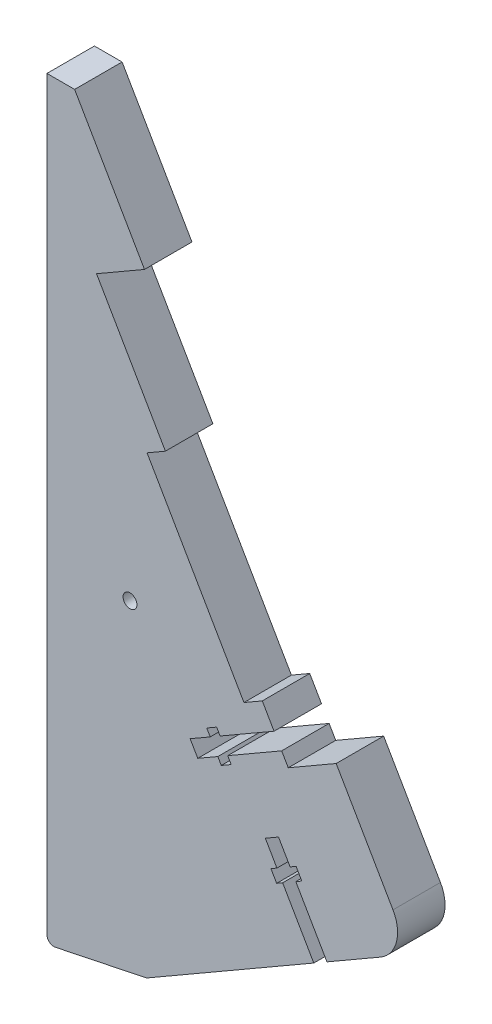
from build123d import *

# Parameters (mm, degrees)
SKETCH1_W                = 100
SKETCH1_H                = 110
BOSS_EXTRUDE1_DEPTH      = 6.86
BOSS_EXTRUDE2_DEPTH      = 6.86
CUT_EXTRUDE1_DEPTH       = 84.419927529
CUT_EXTRUDE1_DEPTH_BACK  = 84.419927529
CUT_EXTRUDE5_DEPTH       = 84.419927529
CUT_EXTRUDE6_DEPTH       = 84.419927529
SKETCH7_W                = 42
SKETCH7_H                = 3.55
CUT_EXTRUDE7_DEPTH       = 84.419927529
SKETCH8_W                = 5
SKETCH8_H                = 7.62
CUT_EXTRUDE8_DEPTH       = 84.419927529
CUT_EXTRUDE9_DEPTH       = 84.419927529
LPATTERN1_COUNT          = 2
LPATTERN1_PITCH          = 49.4
SKETCH15_W               = 6.5
SKETCH15_H               = 9.5
BOSS_EXTRUDE3_DEPTH      = 6.86
CUT_EXTRUDE14_START      = -6.86
CUT_EXTRUDE14_DEPTH      = 6.86
BOSS_EXTRUDE4_DEPTH      = 6.86
FILLET3_R                = 5
FILLET4_R                = 7
CUT_EXTRUDE11_DEPTH      = 84.419927529
BOSS_EXTRUDE5_DEPTH      = 6.86
CUT_EXTRUDE12_DEPTH      = 84.419927529
CUT_EXTRUDE12_DEPTH_BACK = 84.419927529
SKETCH21_R               = 1
CUT_EXTRUDE13_DEPTH      = 84.419927529
CUT_EXTRUDE15_DEPTH      = 84.419927529
CUT_EXTRUDE15_DEPTH_BACK = 84.419927529
CUT_EXTRUDE16_DEPTH      = 84.419927529
CUT_EXTRUDE16_DEPTH_BACK = 84.419927529
FILLET2_R                = 1
BOSS_EXTRUDE6_DEPTH      = 6.86
CUT_EXTRUDE17_DEPTH      = 84.419927529
BOSS_EXTRUDE9_DEPTH      = 6.86


# Read off the part's stored shape, not the designer's step: Cut-Extrude14
with BuildPart() as part:
    # Sketch1 → Boss-Extrude1 (new body)
    with BuildSketch(Plane.XY):
        Rectangle(SKETCH1_W, SKETCH1_H)
    extrude(amount=BOSS_EXTRUDE1_DEPTH)

    # Sketch14 → Boss-Extrude2 (add)
    with BuildSketch(Plane.XY.offset(6.86)):
        with BuildLine():
            Line((-50, 44), (-56.9, 44))
            Line((-56.9, 44), (-57.252653961, 46))
            Line((-57.252653961, 46), (-60.252653961, 46))
            ThreePointArc((-60.252653961, 46), (-62.140394827, 27.177051725), (-56.9, 9))
            Line((-56.9, 9), (-50, 9))
            Line((-50, 9), (-50, 44))
        make_face()
    extrude(amount=-BOSS_EXTRUDE2_DEPTH)

    # Sketch9 → Cut-Extrude1 (cut, two sides: drawn at the far end of the back side and taken through both)
    with BuildSketch(Plane.XY.offset(6.86).offset(-CUT_EXTRUDE1_DEPTH_BACK)):
        Polygon((-202.691345573, 326.397371639), (-46, 55), (2.5, -29.004464167), (-49.825975731, -59.214880341), (-321.22334737, -215.906225914), (291.08659924, -349.739606366), (409.618601037, 192.563991188), align=None)
    extrude(amount=CUT_EXTRUDE1_DEPTH + CUT_EXTRUDE1_DEPTH_BACK, mode=Mode.SUBTRACT)

    # Sketch11 → Cut-Extrude5 (cut, through all)
    with BuildSketch(Plane.XY.offset(6.86)):
        Polygon((-35.90593882, 37.516573181), (-8.20593882, -10.461234188), (-15.13414205, -14.461234188), (-42.83414205, 33.516573181), align=None)
    extrude(amount=-CUT_EXTRUDE5_DEPTH, mode=Mode.SUBTRACT)

    # Sketch12 → Cut-Extrude6 (cut, through all)
    with BuildSketch(Plane.XY.offset(6.86)):
        Polygon((-18.88414205, -7.96604366), (-21.534179786, -9.49604366), (-35.534179786, 14.752667646), (-32.88414205, 16.282667646), align=None)
    extrude(amount=-CUT_EXTRUDE6_DEPTH, mode=Mode.SUBTRACT)

    # Sketch7 → Cut-Extrude7 (cut, through all)
    with BuildSketch(Plane.XY.offset(6.86)):
        with Locations((-50, -34)):
            Rectangle(SKETCH7_W, SKETCH7_H)
    extrude(amount=-CUT_EXTRUDE7_DEPTH, mode=Mode.SUBTRACT)

    # Sketch8 → Cut-Extrude8 (cut, through all)
    with BuildSketch(Plane.XY.offset(6.86)):
        with Locations((-36.5, -34)):
            Rectangle(SKETCH8_W, SKETCH8_H)
    extrude(amount=-CUT_EXTRUDE8_DEPTH, mode=Mode.SUBTRACT)

    # Sketch13 → Cut-Extrude9 (cut, through all)
    with BuildSketch(Plane.XY.offset(6.86)):
        Polygon((-41.88414205, 31.871124914), (-40.78414205, 29.965869026), (-48.578370684, 25.465869026), (-48.078370684, 24.599843622), (-49.508178626, 23.774343622), (-50.008178626, 24.640369026), (-52.908497703, 22.965869026), (-54.008497703, 24.871124914), (-51.108178626, 26.545624914), (-51.608178626, 27.411650318), (-50.178370684, 28.237150318), (-49.678370684, 27.371124914), align=None)
        Polygon((-39.45593882, 43.665353548), (-38.35593882, 41.76009766), (-46.150167454, 37.26009766), (-45.650167454, 36.394072256), (-47.079975396, 35.568572256), (-47.579975396, 36.43459766), (-50.480294473, 34.76009766), (-51.580294473, 36.665353548), (-48.679975396, 38.339853548), (-49.179975396, 39.205878952), (-47.750167454, 40.031378952), (-47.250167454, 39.165353548), align=None)
        Polygon((-18.443009001, -24.930108514), (-11.443009001, -37.054464167), (-9.537753113, -35.954464167), (-16.537753113, -23.830108514), align=None)
    cut_extrude9 = extrude(amount=-CUT_EXTRUDE9_DEPTH, mode=Mode.SUBTRACT)

    # LPattern1: Cut-Extrude9 ×2
    with Locations(*[Vector(0.4999999999999939, -0.8660254037844421, 0) * (i * LPATTERN1_PITCH) for i in range(1, LPATTERN1_COUNT)]):
        add(cut_extrude9, mode=Mode.SUBTRACT)

    # Sketch15 → Boss-Extrude3 (add)
    with BuildSketch(Plane.XY.offset(6.86)):
        with Locations((-53.25, -19.75)):
            Rectangle(SKETCH15_W, SKETCH15_H)
    extrude(amount=-BOSS_EXTRUDE3_DEPTH)

    # Cut-Extrude14 outline → Cut-Extrude14 (cut)
    with BuildSketch(Plane.XY.offset(6.86).offset(CUT_EXTRUDE14_START)):
        Polygon((-56.5, -15), (-56.5, -16.500643242), (-50, -15), align=None)
    extrude(amount=CUT_EXTRUDE14_DEPTH, mode=Mode.SUBTRACT)

    # Sketch16 → Boss-Extrude4 (add)
    with BuildSketch(Plane.XY.offset(6.86)):
        Polygon((-35.605117767, -51.004464167), (-34.105117767, -53.602540378), (-36.525588833, -55), (-42.525588833, -55), (-44.558274136, -51.479285778), align=None)
    extrude(amount=-BOSS_EXTRUDE4_DEPTH)

    # Fillet3
    fillet3_edges = [part.edges().sort_by_distance(p)[0] for p in [
        (2.5, -29.004464167, 3.43),
    ]]
    fillet(fillet3_edges, radius=FILLET3_R)

    # Fillet4
    fillet4_edges = [part.edges().sort_by_distance(p)[0] for p in [
        (-56.9, 9, 3.43),
    ]]
    fillet(fillet4_edges, radius=FILLET4_R)

    # Sketch18 → Cut-Extrude11 (cut, through all)
    with BuildSketch(Plane.XY.offset(6.86)):
        Polygon((-17.634534405, -28.330427591), (-13.997227709, -26.230427591), (-13.171727709, -27.660235533), (-16.809034405, -29.760235533), align=None)
    extrude(amount=-CUT_EXTRUDE11_DEPTH, mode=Mode.SUBTRACT)

    # Sketch19 → Boss-Extrude5 (add)
    with BuildSketch(Plane.XY.offset(6.86)):
        Polygon((-24.334179786, -4.646301399), (-23.234179786, -6.551557287), (-25.780294473, -8.021557287), (-26.880294473, -6.116301399), align=None)
    extrude(amount=-BOSS_EXTRUDE5_DEPTH)

    # Sketch20 → Cut-Extrude12 (cut, two sides: drawn at the far end of the back side and taken through both)
    with BuildSketch(Plane.XY.offset(6.86).offset(-CUT_EXTRUDE12_DEPTH_BACK)):
        Polygon((-50, 55), (-50, 44), (-48.060403212, 55), align=None)
    extrude(amount=CUT_EXTRUDE12_DEPTH + CUT_EXTRUDE12_DEPTH_BACK, mode=Mode.SUBTRACT)

    # Sketch21 → Cut-Extrude13 (cut, through all)
    with BuildSketch(Plane.XY.offset(6.86)):
        with Locations((-38, -5)):
            Circle(SKETCH21_R)
    extrude(amount=-CUT_EXTRUDE13_DEPTH, mode=Mode.SUBTRACT)

    # Sketch23 → Cut-Extrude15 (cut, two sides: drawn at the far end of the back side and taken through both)
    with BuildSketch(Plane.XY.offset(6.86).offset(-CUT_EXTRUDE15_DEPTH_BACK)):
        Polygon((207.425051562, 16.452548282), (-35.605117767, -51.004464167), (-50, -55), (-293.030169328, -122.457012449), (-158.11614443, -608.517351106), (342.33907646, -469.607790375), align=None)
    extrude(amount=CUT_EXTRUDE15_DEPTH + CUT_EXTRUDE15_DEPTH_BACK, mode=Mode.SUBTRACT)

    # Sketch25 → Cut-Extrude16 (cut, two sides: drawn at the far end of the back side and taken through both)
    with BuildSketch(Plane(origin=(0, 0, 0), x_dir=(-1, 0, 0), z_dir=(0, 0, -1)).offset(-CUT_EXTRUDE16_DEPTH_BACK)):
        Polygon((-209.546353054, 0.01089), (35.605117767, -51.004464167), (50, -54), (295.15147082, -105.015354167), (193.120762486, -595.318295807), (-311.577061387, -490.29205164), align=None)
    extrude(amount=CUT_EXTRUDE16_DEPTH + CUT_EXTRUDE16_DEPTH_BACK, mode=Mode.SUBTRACT)

    # Fillet2
    fillet2_edges = [part.edges().sort_by_distance(p)[0] for p in [
        (-60.252653961, 46, 3.43),
        (-56.5, -24.5, 3.43),
        (-56.5, -16.500643242, 3.43),
        (-50, -54, 3.43),
    ]]
    fillet(fillet2_edges, radius=FILLET2_R)

    # Sketch26 → Boss-Extrude6 (add)
    with BuildSketch(Plane(origin=(0, 0, 0), x_dir=(-1, 0, 0), z_dir=(0, 0, -1))):
        with BuildLine():
            Line((56.5, -15), (50, -15))
            Line((50, -15), (55.724951054, -16.321709094))
            ThreePointArc((55.724951054, -16.321709094), (56.282608157, -16.673564522), (56.5, -17.296079159))
            Line((56.5, -17.296079159), (56.5, -15))
        make_face()
        Polygon((47.579975396, 36.43459766), (50, 35.037395803), (50, 37.577736987), (48.679975396, 38.339853548), (49.179975396, 39.205878952), (47.750167454, 40.031378952), (47.250167454, 39.165353548), (39.45593882, 43.665353548), (38.35593882, 41.76009766), (46.150167454, 37.26009766), (45.650167454, 36.394072256), (47.079975396, 35.568572256), align=None)
        Polygon((49.678370684, 27.371124914), (41.88414205, 31.871124914), (40.78414205, 29.965869026), (48.578370684, 25.465869026), (48.078370684, 24.599843622), (49.508178626, 23.774343622), (50, 24.62620323), (50, 27.92820323), align=None)
        with BuildLine():
            ThreePointArc((56.5, -23.5), (56.207106781, -24.207106781), (55.5, -24.5))
            Line((55.5, -24.5), (56.5, -24.5))
            Line((56.5, -24.5), (56.5, -23.5))
        make_face()
    extrude(amount=-BOSS_EXTRUDE6_DEPTH)

    # Sketch26<3> → Cut-Extrude17 (cut, through all)
    with BuildSketch(Plane(origin=(0, 0, 0), x_dir=(-1, 0, 0), z_dir=(0, 0, -1))):
        with BuildLine():
            Line((50, 35.037395803), (50, 27.92820323))
            Line((50, 27.92820323), (50.178370684, 28.237150318))
            Line((50.178370684, 28.237150318), (51.608178626, 27.411650318))
            Line((51.608178626, 27.411650318), (51.108178626, 26.545624914))
            Line((51.108178626, 26.545624914), (54.008497703, 24.871124914))
            Line((54.008497703, 24.871124914), (52.908497703, 22.965869026))
            Line((52.908497703, 22.965869026), (50.008178626, 24.640369026))
            Line((50.008178626, 24.640369026), (50, 24.62620323))
            Line((50, 24.62620323), (50, 9))
            Line((50, 9), (52.380008746, 9))
            ThreePointArc((52.380008746, 9), (56.324728806, 10.217337668), (58.897432775, 13.445947531))
            ThreePointArc((58.897432775, 13.445947531), (62.283923616, 29.230647449), (60.464218102, 45.271649399))
            ThreePointArc((60.464218102, 45.271649399), (60.105291207, 45.797386167), (59.50182182, 46))
            Line((59.50182182, 46), (57.252653961, 46))
            Line((57.252653961, 46), (56.9, 44))
            Line((56.9, 44), (50, 44))
            Line((50, 44), (50, 37.577736987))
            Line((50, 37.577736987), (51.580294473, 36.665353548))
            Line((51.580294473, 36.665353548), (50.480294473, 34.76009766))
            Line((50.480294473, 34.76009766), (50, 35.037395803))
        make_face()
        with BuildLine():
            Line((55.724951054, -16.321709094), (50, -15))
            Line((50, -15), (50, -24.5))
            Line((50, -24.5), (55.5, -24.5))
            ThreePointArc((55.5, -24.5), (56.207106781, -24.207106781), (56.5, -23.5))
            Line((56.5, -23.5), (56.5, -17.296079159))
            ThreePointArc((56.5, -17.296079159), (56.282608157, -16.673564522), (55.724951054, -16.321709094))
        make_face()
        with BuildLine():
            Line((56.5, -15), (50, -15))
            Line((50, -15), (55.724951054, -16.321709094))
            ThreePointArc((55.724951054, -16.321709094), (56.282608157, -16.673564522), (56.5, -17.296079159))
            Line((56.5, -17.296079159), (56.5, -15))
        make_face()
        with BuildLine():
            ThreePointArc((56.5, -23.5), (56.207106781, -24.207106781), (55.5, -24.5))
            Line((55.5, -24.5), (56.5, -24.5))
            Line((56.5, -24.5), (56.5, -23.5))
        make_face()
    extrude(amount=-CUT_EXTRUDE17_DEPTH, mode=Mode.SUBTRACT)

    # Sketch29 → Boss-Extrude9 (add)
    with BuildSketch(Plane(origin=(0, 0, 0), x_dir=(-1, 0, 0), z_dir=(0, 0, -1))):
        Polygon((39, -35.775), (50, -35.775), (50, -32.225), (39, -32.225), (39, -30.19), (34, -30.19), (34, -32.225), (29, -32.225), (29, -35.775), (34, -35.775), (34, -37.81), (39, -37.81), align=None)
        Polygon((50, 44), (50, 55), (48.060403212, 55), align=None)
    extrude(amount=-BOSS_EXTRUDE9_DEPTH)


solid = part.part
